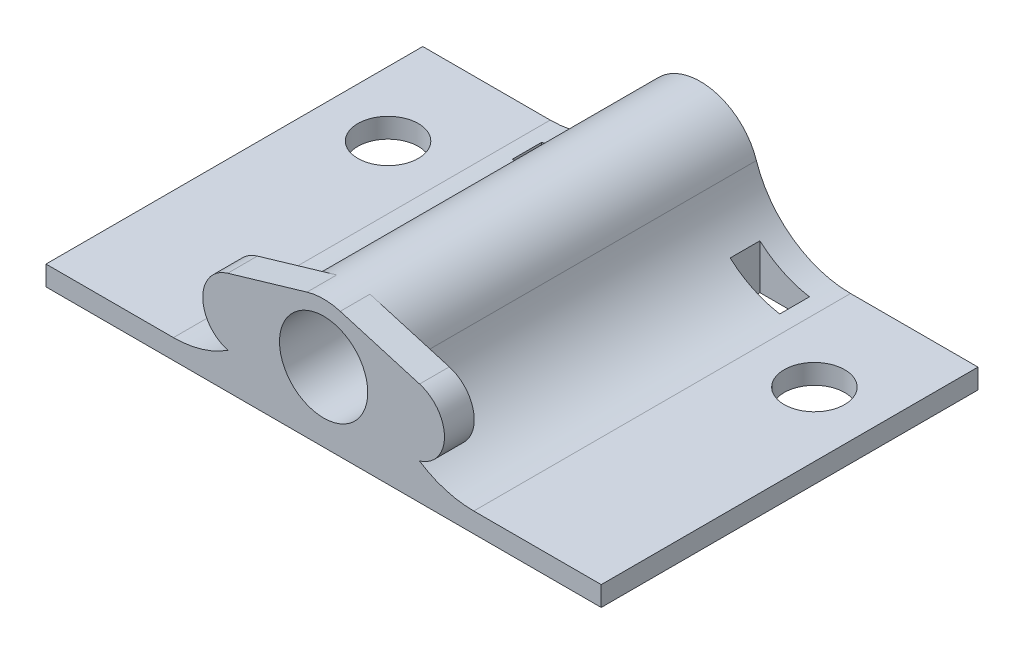
from build123d import *
from build123d.topology import SkipClean

# Parameters (mm, degrees)
ESQUISSE1_R                  = 4.45
BOSS_EXTRU_1_DEPTH           = 1.5
ESQUISSE1_2_R                = 5.95
ESQUISSE1_2_R_2              = 4.45
EXTRU_MINCE1_DEPTH           = 35
ESQUISSE2_R                  = 5.95
ESQUISSE2_R_2                = 4.45
BOSS_EXTRU_2_DEPTH           = 3
ESQUISSE4_W                  = 28
ESQUISSE4_H                  = 38
ESQUISSE4_R                  = 3.05
BOSS_EXTRU_3_DEPTH           = 2
CONG_1_R                     = 10
ESQUISSE5_R                  = 4.45
ENL_V_MAT_EXTRU_1_DEPTH      = 10
ENL_V_MAT_EXTRU_4_DEPTH      = 49.455159684
ENL_V_MAT_EXTRU_4_DEPTH_BACK = 49.455159684
ESQUISSE8_W                  = 5
ESQUISSE8_H                  = 3


with BuildPart() as part:
    # Esquisse1 → Boss.-Extru.1 (new body)
    with BuildSketch(Plane.XY):
        Circle(ESQUISSE1_R)
    extrude(amount=BOSS_EXTRU_1_DEPTH)

    # Esquisse1<2> → Extru.-Mince1 (add)
    with BuildSketch(Plane.XY):
        Circle(ESQUISSE1_2_R)
        Circle(ESQUISSE1_2_R_2, mode=Mode.SUBTRACT)
    extrude(amount=EXTRU_MINCE1_DEPTH)

    # Esquisse2 → Boss.-Extru.2 (add)
    # profile 1 of 3: a face of its own
    with BuildSketch(Plane.XY.offset(35)):
        with BuildLine():
            Line((9.677371186, 3.358041833), (1.677371186, 5.708671115))
            ThreePointArc((1.677371186, 5.708671115), (4.76355217, 3.565258858), (5.95, 0))
            ThreePointArc((5.95, 0), (4.76355217, -3.565258858), (1.677371186, -5.708671115))
            Line((1.677371186, -5.708671115), (9.677371186, -3.358041833))
            ThreePointArc((9.677371186, -3.358041833), (11.492771765, -2.097211093), (12.190682253, 0))
            ThreePointArc((12.190682253, 0), (11.492771765, 2.097211093), (9.677371186, 3.358041833))
        make_face()
    # profile 2 of 3: a face of its own
    with BuildSketch(Plane.XY.offset(35)):
        with BuildLine():
            ThreePointArc((-1.677371186, -5.708671115), (-5.95, 0), (-1.677371186, 5.708671115))
            Line((-1.677371186, 5.708671115), (-9.677371186, 3.358041833))
            ThreePointArc((-9.677371186, 3.358041833), (-11.492771765, 2.097211093), (-12.190682253, 0))
            ThreePointArc((-12.190682253, 0), (-11.492771765, -2.097211093), (-9.677371186, -3.358041833))
            Line((-9.677371186, -3.358041833), (-1.677371186, -5.708671115))
        make_face()
    # profile 3 of 3: a face of its own
    with BuildSketch(Plane.XY.offset(35)):
        with Locations(Location((0, 0, 0), (0, 0, 106.374299713))):
            Circle(ESQUISSE2_R)
        Circle(ESQUISSE2_R_2, mode=Mode.SUBTRACT)
    extrude(amount=BOSS_EXTRU_2_DEPTH)

    # Esquisse4 → Boss.-Extru.3 (add)
    # profile 1 of 4: a face of its own
    with BuildSketch(Plane(origin=(0, -5, 0), x_dir=(1, 0, 0), z_dir=(0, 1, 0))):
        with Locations((14, -19)):
            Rectangle(ESQUISSE4_W, ESQUISSE4_H)
        with Locations(Location((21.5, -10, 0), (0, 0, 270))):
            Circle(ESQUISSE4_R, mode=Mode.SUBTRACT)
    # profile 2 of 4: a face of its own
    with BuildSketch(Plane(origin=(0, -5, 0), x_dir=(1, 0, 0), z_dir=(0, 1, 0))):
        with Locations((-14, -19)):
            Rectangle(ESQUISSE4_W, ESQUISSE4_H)
        with Locations(Location((-21.5, -10, 0), (0, 0, 270))):
            Circle(ESQUISSE4_R, mode=Mode.SUBTRACT)
    # profile 3 of 4: a face of its own
    with BuildSketch(Plane(origin=(0, -5, 0), x_dir=(1, 0, 0), z_dir=(0, 1, 0))):
        with Locations((-14, -19)):
            Rectangle(ESQUISSE4_W, ESQUISSE4_H)
        with Locations(Location((-21.5, -10, 0), (0, 0, 270))):
            Circle(ESQUISSE4_R, mode=Mode.SUBTRACT)
    # profile 4 of 4: a face of its own
    with BuildSketch(Plane(origin=(0, -5, 0), x_dir=(1, 0, 0), z_dir=(0, 1, 0))):
        with Locations((14, -19)):
            Rectangle(ESQUISSE4_W, ESQUISSE4_H)
        with Locations(Location((21.5, -10, 0), (0, 0, 270))):
            Circle(ESQUISSE4_R, mode=Mode.SUBTRACT)
    extrude(amount=-BOSS_EXTRU_3_DEPTH)

    # Congé1
    # the kernel refuses this fillet: 10 mm, written as the material it adds along each edge
    with BuildSketch(Plane(origin=(-3.225290685, -5, 64.801871004), x_dir=(-0.33303824301553137, 0.9429133198174304, 0), z_dir=(0, 0, -1))) as cong_1_piece_1_section:
        with BuildLine():
            CenterArc((13.399198301, -7.90985002), CONG_1_R, 127.722343038, 71.730945551)
            Line((3.970065103, -11.24023245), (0, 0))
            ThreePointArc((0, 0), (3.640421456, -1.243639238), (7.280842913, 0))
        make_face()
    cong_1_piece_1 = extrude(amount=64.801871004, mode=Mode.PRIVATE)
    cong_1_piece_1 = split(cong_1_piece_1, bisect_by=Plane(origin=(-7.500746377, -3.487839575, 38), z_dir=(0, 0, -1)), keep=Keep.TOP, mode=Mode.PRIVATE)
    add(cong_1_piece_1)
    with BuildSketch(Plane(origin=(3.225290685, -5, 64.801871004), x_dir=(0.3330382430155311, 0.9429133198174307, 0), z_dir=(0, 0, -1))) as cong_1_piece_2_section:
        with BuildLine():
            CenterArc((13.399198301, 7.90985002), CONG_1_R, 160.546711411, 71.730945551)
            Line((3.970065103, 11.24023245), (0, 0))
            ThreePointArc((0, 0), (3.640421456, 1.243639238), (7.280842913, 0))
        make_face()
    cong_1_piece_2 = extrude(amount=64.801871004, mode=Mode.PRIVATE)
    cong_1_piece_2 = split(cong_1_piece_2, bisect_by=Plane(origin=(7.500746377, -3.487839575, 38), z_dir=(0, 0, -1)), keep=Keep.TOP, mode=Mode.PRIVATE)
    add(cong_1_piece_2)

    # Esquisse5 → Enlèv. mat.-Extru.1 (cut)
    with SkipClean():  # the faces are left unmerged after this step: merging them gives an invalid solid
        with BuildSketch(Plane(origin=(0, 0, 0), x_dir=(-1, 0, 0), z_dir=(0, 0, -1))):
            Circle(ESQUISSE5_R)
        extrude(amount=-ENL_V_MAT_EXTRU_1_DEPTH, mode=Mode.SUBTRACT)
    add(part.part.scale(1), mode=Mode.REPLACE)  # the faces are merged on a copy

    # Esquisse8 → Enlèv. mat.-Extru.4 (cut, two sides: drawn at the far end of the back side and taken through both)
    with BuildSketch(Plane(origin=(0, -5, 0), x_dir=(1, 0, 0), z_dir=(0, 1, 0)).offset(-ENL_V_MAT_EXTRU_4_DEPTH_BACK)):
        with Locations((-11, -4)):
            Rectangle(ESQUISSE8_W, ESQUISSE8_H)
        with Locations((11, -4)):
            Rectangle(ESQUISSE8_W, ESQUISSE8_H)
    extrude(amount=ENL_V_MAT_EXTRU_4_DEPTH + ENL_V_MAT_EXTRU_4_DEPTH_BACK, mode=Mode.SUBTRACT)


solid = part.part
